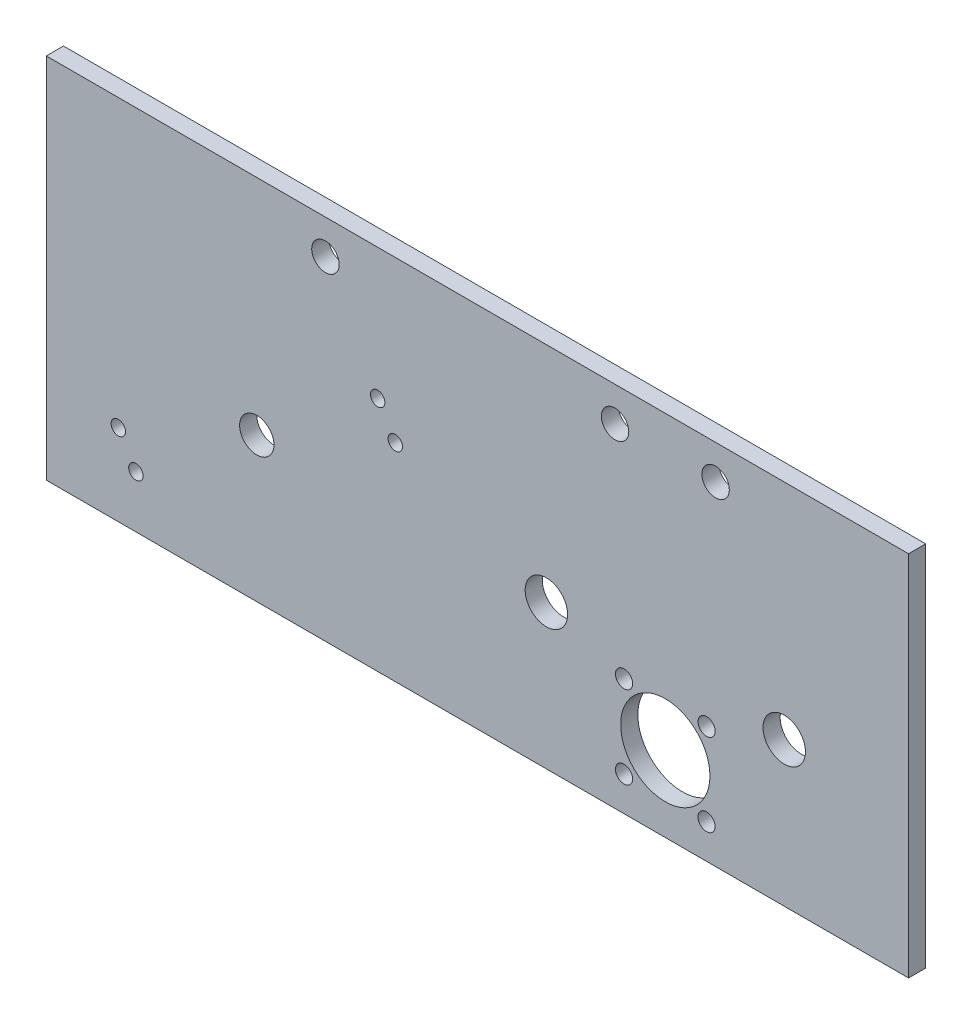
from build123d import *

# Parameters (mm, degrees)
SKETCH_1_W        = 251.159735697
SKETCH_1_H        = 107.02081528
SKETCH_1_R        = 13
SKETCH_1_R_2      = 2.5
SKETCH_1_R_3      = 6.183267946
SKETCH_1_R_4      = 5
SKETCH_1_R_5      = 4
EXTRUDE_1_DEPTH   = 5
HOLE_WIZARD_M51_D = 4.2


with BuildPart() as part:
    # Эскиз1 → Бобышка-Вытянуть1 (new body)
    with BuildSketch(Plane.XY):
        with Locations((-54.727041441, 31.48959236)):
            Rectangle(SKETCH_1_W, SKETCH_1_H)
        Circle(SKETCH_1_R, mode=Mode.SUBTRACT)
        with Locations((-12.02081528, 12.02081528)):
            Circle(SKETCH_1_R_2, mode=Mode.SUBTRACT)
        with Locations((12.02081528, 12.02081528)):
            Circle(SKETCH_1_R_2, mode=Mode.SUBTRACT)
        with Locations((12.02081528, -12.02081528)):
            Circle(SKETCH_1_R_2, mode=Mode.SUBTRACT)
        with Locations((-12.02081528, -12.02081528)):
            Circle(SKETCH_1_R_2, mode=Mode.SUBTRACT)
        with Locations((-34.641016151, 20)):
            Circle(SKETCH_1_R_3, mode=Mode.SUBTRACT)
        with Locations((34.641016151, 20)):
            Circle(SKETCH_1_R_3, mode=Mode.SUBTRACT)
        with Locations((-118.991612597, 20)):
            Circle(SKETCH_1_R_4, mode=Mode.SUBTRACT)
        with Locations((-14.641016151, 75)):
            Circle(SKETCH_1_R_5, mode=Mode.SUBTRACT)
        with Locations((14.641016151, 75)):
            Circle(SKETCH_1_R_5, mode=Mode.SUBTRACT)
        with Locations((-98.991612597, 75)):
            Circle(SKETCH_1_R_5, mode=Mode.SUBTRACT)
    extrude(amount=EXTRUDE_1_DEPTH)

    # Отверстие обработанное метчиком M51 (through all)
    with Locations(Plane(origin=(0, 0, 0), x_dir=(-1, 0, 0), z_dir=(0, 0, -1))):
        with Locations((159.33060151, 1.73073692), (154.202898705, -6.854521605), (83.78032649, 46.854521605), (78.652623685, 38.26926308)):
            Hole(HOLE_WIZARD_M51_D / 2)


solid = part.part
